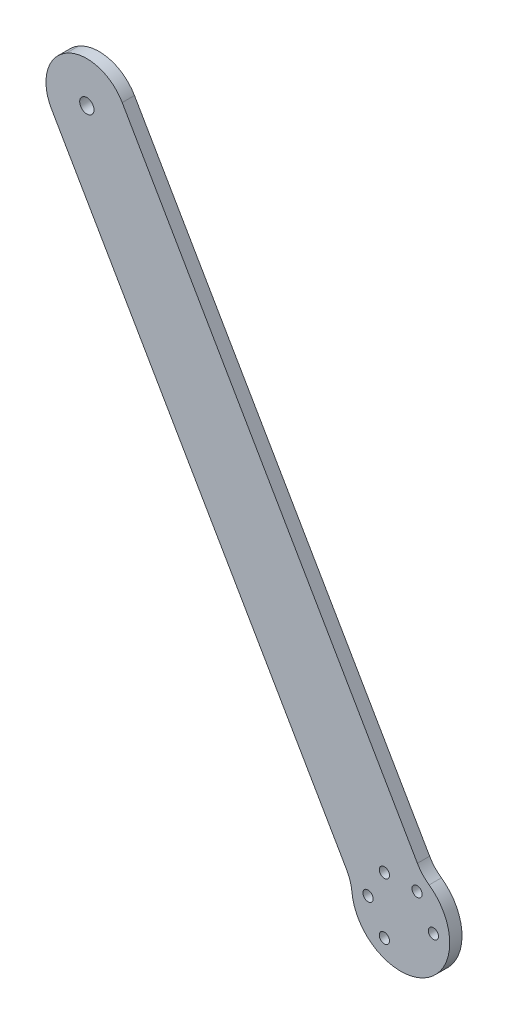
from build123d import *

# Parameters (mm, degrees)
SKETCH1_R           = 1.75
SKETCH1_R_2         = 1.25
BOSS_EXTRUDE1_DEPTH = 3
FILLET1_R           = 10


with BuildPart() as part:
    # Sketch1 → Boss-Extrude1 (new body)
    with BuildSketch(Plane.XY):
        with BuildLine():
            Line((-90.476878828, 136.710551041), (-11.976878828, 0.744562647))
            ThreePointArc((-11.976878828, 0.744562647), (6, -10.392304845), (5.343629247, 10.744562647))
            Line((5.343629247, 10.744562647), (-73.156370753, 146.710551041))
            Line((-73.156370753, 146.710551041), (-90.476878828, 136.710551041))
        make_face()
        with Locations((-76.81662479, 133.050297003)):
            Circle(SKETCH1_R, mode=Mode.SUBTRACT)
        with Locations((8, 0)):
            Circle(SKETCH1_R_2, mode=Mode.SUBTRACT)
        with Locations((-4, -6.92820323)):
            Circle(SKETCH1_R_2, mode=Mode.SUBTRACT)
        with Locations((-8, 0)):
            Circle(SKETCH1_R_2, mode=Mode.SUBTRACT)
        with Locations((-4, 6.92820323)):
            Circle(SKETCH1_R_2, mode=Mode.SUBTRACT)
        with Locations((4, 6.92820323)):
            Circle(SKETCH1_R_2, mode=Mode.SUBTRACT)
    extrude(amount=BOSS_EXTRUDE1_DEPTH)

    # Fillet1
    fillet1_edges = [part.edges().sort_by_distance(p)[0] for p in [
        (-11.976878828, 0.744562647, 1.5),
        (5.343629247, 10.744562647, 1.5),
        (-90.476878828, 136.710551041, 1.5),
        (-73.156370753, 146.710551041, 1.5),
    ]]
    fillet(fillet1_edges, radius=FILLET1_R - 0.0001)  # a hair under: the kernel refuses the full size


solid = part.part
